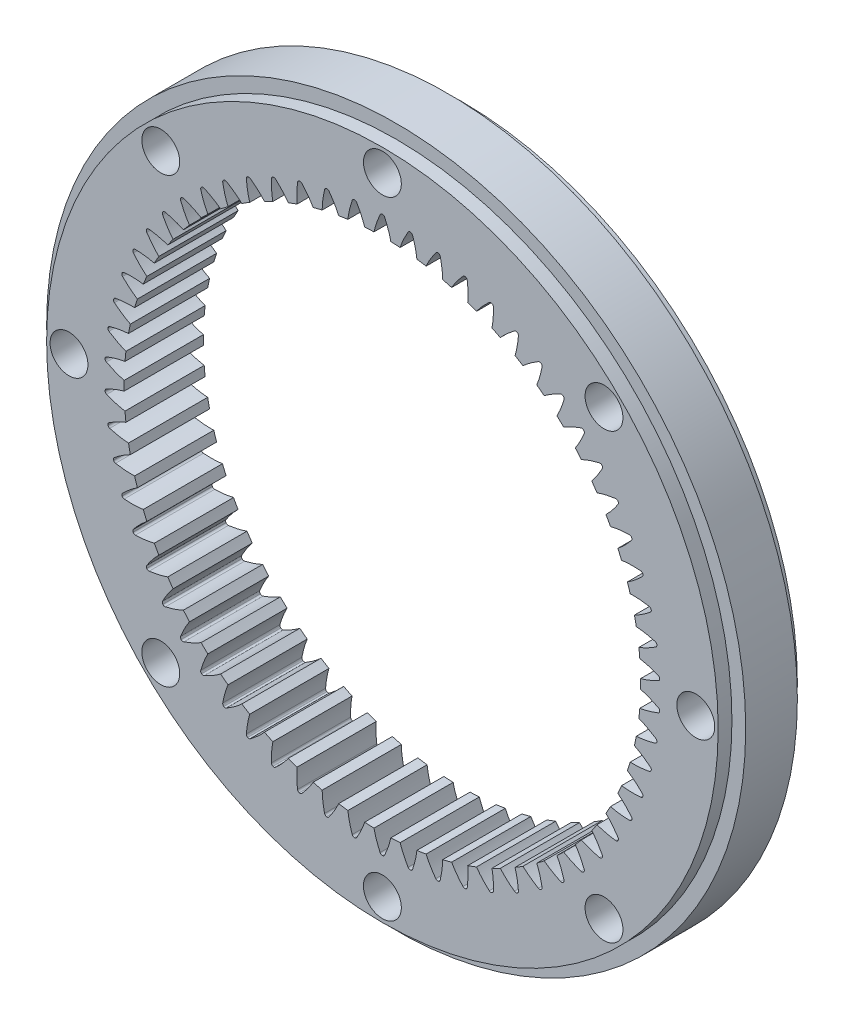
from build123d import *

# Parameters (mm, degrees)
SKETCH_1_R               = 101.5
SKETCH_1_R_2             = 75
EXTRUDE_1_DEPTH          = 23
CUT_EXTRUDE_1_DEPTH      = 146.373656486
PATTERN_CIRCULAR_1_COUNT = 62
SKETCH_3_R               = 5.5
CUT_EXTRUDE_2_DEPTH      = 146.373656641
PATTERN_CIRCULAR_2_COUNT = 8
SKETCH_4_W               = 4
SKETCH_4_H               = 4


with BuildPart() as part:
    # 草图1 → 凸台-拉伸1 (new body)
    with BuildSketch(Plane.XY):
        Circle(SKETCH_1_R)
        Circle(SKETCH_1_R_2, mode=Mode.SUBTRACT)
    extrude(amount=EXTRUDE_1_DEPTH)

    # 草图2 → 切除-拉伸1 (cut, symmetric)
    with BuildSketch(Plane.XY):
        with BuildLine():
            ThreePointArc((2.448369144, 74.960025937), (0, 75), (-2.448369144, 74.960025937))
            add(Edge.make_bspline(
                [(-2.448369144, 74.960025937), (-2.348835519, 75.431309712), (-2.060161731, 76.562402917), (-1.478490923, 78.322624936), (-0.935733491, 79.580376893), (-0.659154778, 80.207475487)],
                knots=[0.268524397, 0.268524397, 0.268524397, 0.268524397, 0.44444648, 0.694445613, 0.944634336, 0.944634336, 0.944634336, 0.944634336], degree=3))
            ThreePointArc((-0.659154778, 80.207475487), (-0.40102298, 80.511355034), (-0.018844844, 80.624997798))
            ThreePointArc((-0.018844844, 80.624997798), (0, 80.625), (0.018844844, 80.624997798))
            ThreePointArc((0.018844844, 80.624997798), (0.40102298, 80.511355034), (0.659154778, 80.207475487))
            add(Edge.make_bspline(
                [(2.448369144, 74.960025937), (2.348835519, 75.431309712), (2.060161731, 76.562402917), (1.478490923, 78.322624936), (0.935733491, 79.580376893), (0.659154778, 80.207475487)],
                knots=[0.268524397, 0.268524397, 0.268524397, 0.268524397, 0.44444648, 0.694445613, 0.944634336, 0.944634336, 0.944634336, 0.944634336], degree=3))
        make_face()
    cut_extrude_1 = extrude(amount=CUT_EXTRUDE_1_DEPTH, both=True, mode=Mode.SUBTRACT)

    # 阵列(圆周)1: 切除-拉伸1 ×62 about axis
    pattern_circular_1_axis = Axis((0, 0, -20.988024297), (0, 0, 1))
    for i in range(1, PATTERN_CIRCULAR_1_COUNT):
        add(cut_extrude_1.rotate(pattern_circular_1_axis, i * 360 / PATTERN_CIRCULAR_1_COUNT), mode=Mode.SUBTRACT)

    # 草图3 → 切除-拉伸2 (cut, symmetric)
    with BuildSketch(Plane.XY):
        with Locations((0, 91)):
            Circle(SKETCH_3_R)
    cut_extrude_2 = extrude(amount=CUT_EXTRUDE_2_DEPTH, both=True, mode=Mode.SUBTRACT)

    # 阵列(圆周)2: 切除-拉伸2 ×8 about axis
    pattern_circular_2_axis = Axis((0, 0, -20.988024297), (0, 0, 1))
    for i in range(1, PATTERN_CIRCULAR_2_COUNT):
        add(cut_extrude_2.rotate(pattern_circular_2_axis, i * 360 / PATTERN_CIRCULAR_2_COUNT), mode=Mode.SUBTRACT)

    # 草图4 → 切除-旋转1 (revolve, cut)
    with BuildSketch(Plane(origin=(0, 0, 0), x_dir=(1, 0, 0), z_dir=(0, 1, 0))):
        with Locations((-99.5, -21)):
            Rectangle(SKETCH_4_W, SKETCH_4_H)
    cut_revolve_1 = revolve(axis=Axis((0, 0, -20.988024297), (0, 0, 1)), mode=Mode.SUBTRACT)

    # 镜向1: 切除-旋转1 across plane
    add(cut_revolve_1.mirror(Plane(origin=(0, 0, 11.5), x_dir=(1, 0, 0), z_dir=(0, 0, -1))), mode=Mode.SUBTRACT)


solid = part.part
